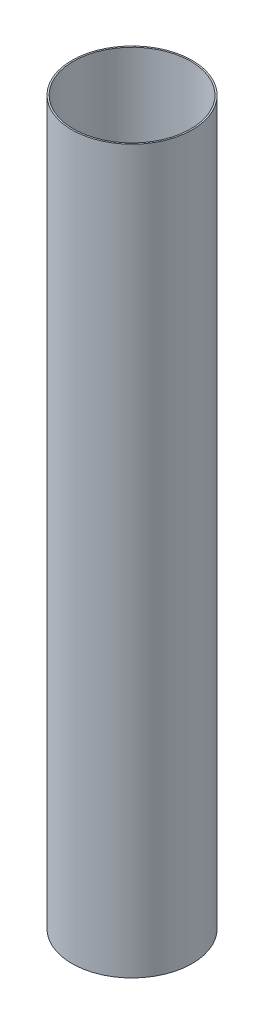
from build123d import *

# Parameters (mm, degrees)
SKETCH1_R           = 50.8
SKETCH1_R_2         = 49.53
BOSS_EXTRUDE1_DEPTH = 609.6


with BuildPart() as part:
    # Sketch1 → Boss-Extrude1 (new body)
    with BuildSketch(Plane(origin=(0, 0, 0), x_dir=(1, 0, 0), z_dir=(0, 1, 0))):
        Circle(SKETCH1_R)
        Circle(SKETCH1_R_2, mode=Mode.SUBTRACT)
    extrude(amount=BOSS_EXTRUDE1_DEPTH)


solid = part.part
